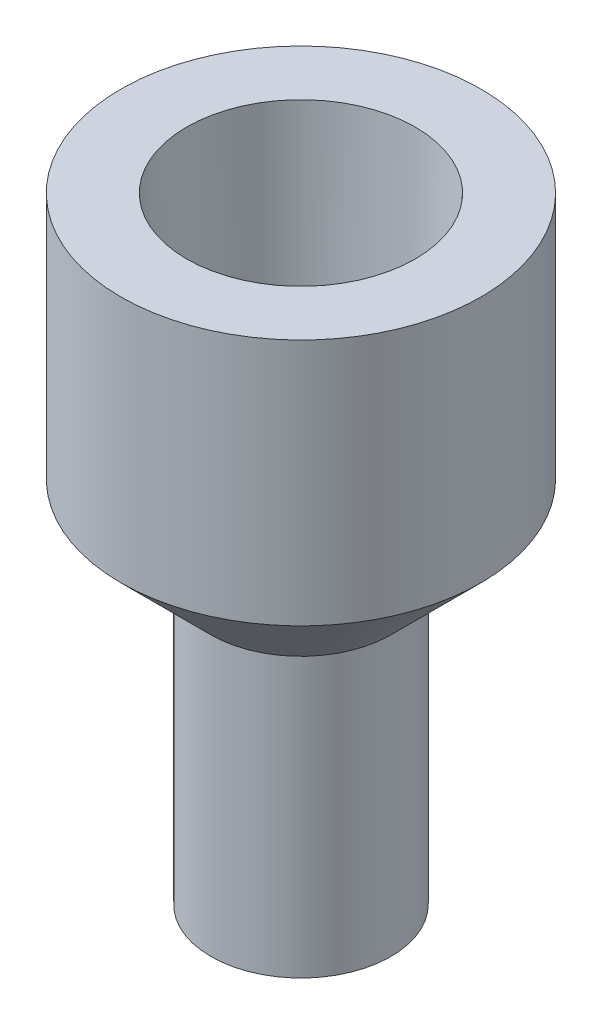
from build123d import *

# Parameters (mm, degrees)
SKETCH1_R           = 5.08
BOSS_EXTRUDE1_DEPTH = 20.8
SKETCH2_R           = 10.16
BOSS_EXTRUDE2_DEPTH = 13.97
SKETCH4_R           = 6.052157879
SKETCH3_R           = 6.450000054
CHAMFER1_SIZE       = 5.08
SKETCH6_R           = 2.325
SKETCH5_R           = 2.525


with BuildPart() as part:
    # Sketch1 → Boss-Extrude1 (new body)
    with BuildSketch(Plane(origin=(0, 0, 0), x_dir=(1, 0, 0), z_dir=(0, 1, 0))):
        with Locations(Location((0, 0, 0), (0, 0, 270))):
            Circle(SKETCH1_R)
    extrude(amount=BOSS_EXTRUDE1_DEPTH)

    # Sketch2 → Boss-Extrude2 (add)
    with BuildSketch(Plane(origin=(0, 20.8, 0), x_dir=(1, 0, 0), z_dir=(0, 1, 0))):
        with Locations(Location((0, 0, 0), (0, 0, 270))):
            Circle(SKETCH2_R)
    extrude(amount=BOSS_EXTRUDE2_DEPTH)

    # Sketch4 → Cut-Loft1 section 0
    with BuildSketch(Plane(origin=(0, 23.34, 0), x_dir=(-1, 0, 0), z_dir=(0, -1, 0))):
        Circle(SKETCH4_R)
    # Sketch3 → Cut-Loft1 section 1
    with BuildSketch(Plane(origin=(0, 34.77, 0), x_dir=(1, 0, 0), z_dir=(0, 1, 0))):
        Circle(SKETCH3_R)
    loft(mode=Mode.SUBTRACT)

    # Chamfer1
    chamfer1_edges = [part.edges().sort_by_distance(p)[0] for p in [
        (0, 20.8, -5.08),
    ]]
    chamfer(chamfer1_edges, length=CHAMFER1_SIZE - 0.0001)  # a hair under: the kernel refuses the full size

    # Sketch6 → Cut-Loft2 section 0
    with BuildSketch(Plane(origin=(0, 18.26, 0), x_dir=(-1, 0, 0), z_dir=(0, -1, 0))):
        Circle(SKETCH6_R)
    # Sketch5 → Cut-Loft2 section 1
    with BuildSketch(Plane.XZ):
        Circle(SKETCH5_R)
    loft(mode=Mode.SUBTRACT)


solid = part.part
